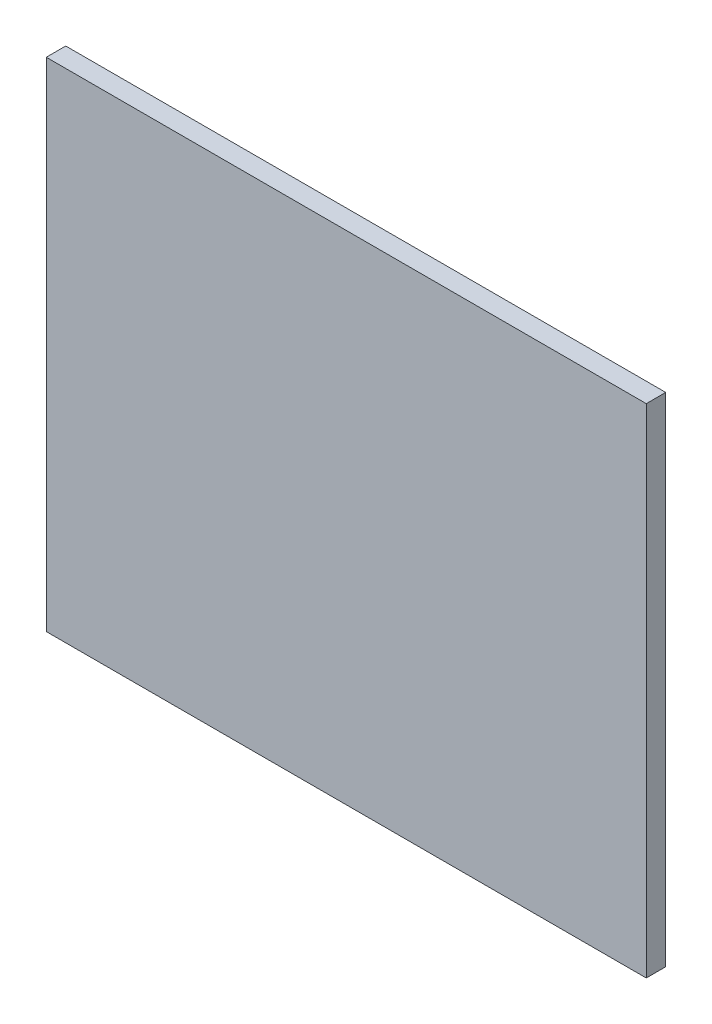
from build123d import *

# Parameters (mm, degrees)
SKETCH1_W          = 58.5
SKETCH1_H          = 48.5
BASE_FLANGE1_DEPTH = 1.89738


# Sheet-metal steps are written as plain solids
with BuildPart() as part:
    # Sketch1 → Base-Flange1 (new body)
    with BuildSketch(Plane.XY):
        with Locations((-14.10548419, -2.621372257)):
            Rectangle(SKETCH1_W, SKETCH1_H)
    extrude(amount=-BASE_FLANGE1_DEPTH)


solid = part.part
